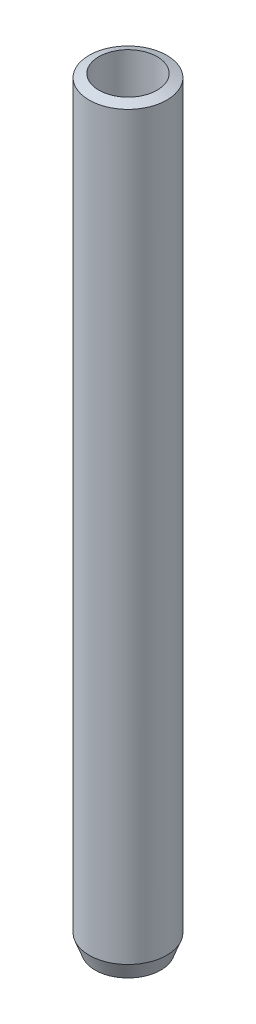
from build123d import *

# Parameters (mm, degrees)
SKETCH1_R           = 12.5
BOSS_EXTRUDE1_DEPTH = 245.358296
SKETCH2_R           = 9.365602206
CUT_EXTRUDE1_DEPTH  = 246.994295495
CHAMFER1_SIZE       = 1.932979
CHAMFER1_SIZE_2     = 5.126058


with BuildPart() as part:
    # Sketch1 → Boss-Extrude1 (new body)
    with BuildSketch(Plane(origin=(0, 0, 0), x_dir=(1, 0, 0), z_dir=(0, 1, 0))):
        with Locations(Location((0, 0, 0), (0, 0, 270))):
            Circle(SKETCH1_R)
    extrude(amount=BOSS_EXTRUDE1_DEPTH)

    # Sketch2 → Cut-Extrude1 (cut, through all)
    with BuildSketch(Plane(origin=(0, 0, 0), x_dir=(1, 0, 0), z_dir=(0, 1, 0))):
        with Locations(Location((0, 0, 0), (0, 0, 270))):
            Circle(SKETCH2_R)
    extrude(amount=CUT_EXTRUDE1_DEPTH, mode=Mode.SUBTRACT)

    # Chamfer1
    # the kernel refuses this chamfer: 5.126058, 1.932979 mm, written as the material it takes off along each edge
    with BuildSketch(Plane(origin=(0, 245.358296, 0), x_dir=(0, 0, 1), z_dir=(-1, 0, 0))) as chamfer1_piece_1:
        Polygon((12.5, -CHAMFER1_SIZE), (12.5 - CHAMFER1_SIZE_2, 0), (12.5, 0), align=None)
    revolve(axis=Axis((0, 245.358296, 0), (0, 1, 0)), mode=Mode.SUBTRACT)
    with BuildSketch(Plane(origin=(0, 0, 0), x_dir=(0, 0, 1), z_dir=(-1, 0, 0))) as chamfer1_piece_2:
        Polygon((12.5, CHAMFER1_SIZE_2), (12.5 - CHAMFER1_SIZE, 0), (12.5, 0), align=None)
    revolve(axis=Axis((0, 0, 0), (0, 1, 0)), mode=Mode.SUBTRACT)


solid = part.part
